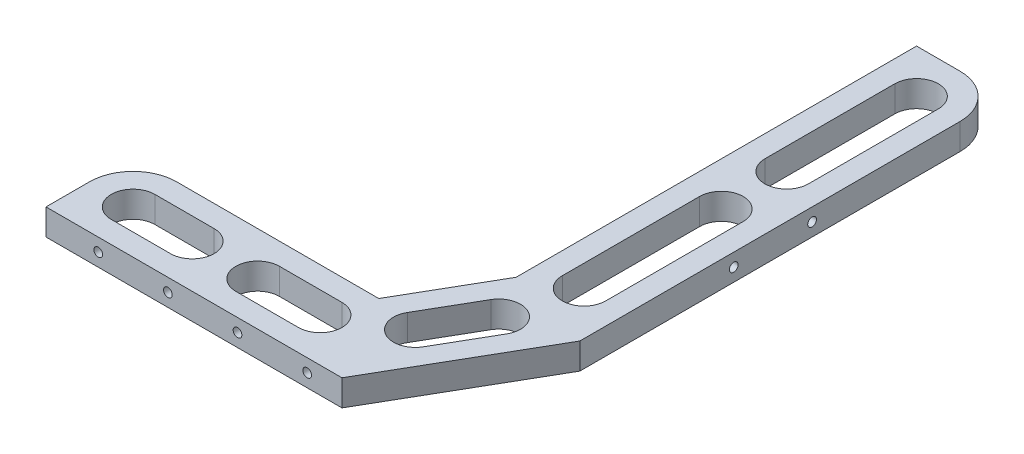
from build123d import *

# Parameters (mm, degrees)
BOSS_EXTRUDE1_DEPTH             = 15
CUT_EXTRUDE1_DEPTH              = 403.523291252
FILLET1_R                       = 25
TAP_DRILL_FOR_M6X1_0_TAP1_D     = 5
TAP_DRILL_FOR_M6X1_0_TAP1_DEPTH = 9
TAP_DRILL_FOR_M6X1_0_TAP1_TIP   = 1.502151548
TAP_DRILL_FOR_M6X1_0_TAP2_D     = 5
TAP_DRILL_FOR_M6X1_0_TAP2_DEPTH = 9
TAP_DRILL_FOR_M6X1_0_TAP2_TIP   = 1.502151548


# Read off the part's stored shape, not the designer's step: Tap Drill for M6x1.0 Tap3
with BuildPart() as part:
    # Sketch1 → Boss-Extrude1 (new body)
    with BuildSketch(Plane(origin=(0, 0, 0), x_dir=(1, 0, 0), z_dir=(0, 1, 0))):
        Polygon((-230, 50), (-88.867513459, 50), (-60, 100), (-60, 330), (-10, 330), (-10, 86.602540378), (-60, 0), (-230, 0), align=None)
    extrude(amount=BOSS_EXTRUDE1_DEPTH)

    # Sketch2 → Cut-Extrude1 (cut, through all)
    with BuildSketch(Plane(origin=(0, 15, 0), x_dir=(1, 0, 0), z_dir=(0, 1, 0))):
        with BuildLine():
            Line((-133.466878365, 37.5), (-97.527767497, 37.5))
            ThreePointArc((-97.527767497, 37.5), (-85.027767497, 25), (-97.527767497, 12.5))
            Line((-97.527767497, 12.5), (-133.466878365, 12.5))
            ThreePointArc((-133.466878365, 12.5), (-145.966878365, 25), (-133.466878365, 37.5))
        make_face()
        with BuildLine():
            Line((-73.712068893, 51.25), (-56.178079351, 81.619760746))
            ThreePointArc((-56.178079351, 81.619760746), (-39.102761804, 86.195078293), (-34.527444257, 69.119760746))
            Line((-34.527444257, 69.119760746), (-52.061433799, 38.75))
            ThreePointArc((-52.061433799, 38.75), (-69.136751346, 34.174682453), (-73.712068893, 51.25))
        make_face()
        with BuildLine():
            Line((-22.5, 192.900635095), (-22.5, 114.006793797))
            ThreePointArc((-22.5, 114.006793797), (-35, 101.506793797), (-47.5, 114.006793797))
            Line((-47.5, 114.006793797), (-47.5, 192.900635095))
            ThreePointArc((-47.5, 192.900635095), (-35, 205.400635095), (-22.5, 192.900635095))
        make_face()
        with BuildLine():
            Line((-47.5, 230.400635095), (-47.5, 305))
            ThreePointArc((-47.5, 305), (-35, 317.5), (-22.5, 305))
            Line((-22.5, 305), (-22.5, 230.400635095))
            ThreePointArc((-22.5, 230.400635095), (-35, 217.900635095), (-47.5, 230.400635095))
        make_face()
        with BuildLine():
            Line((-205, 37.5), (-170.966878365, 37.5))
            ThreePointArc((-170.966878365, 37.5), (-158.466878365, 25), (-170.966878365, 12.5))
            Line((-170.966878365, 12.5), (-205, 12.5))
            ThreePointArc((-205, 12.5), (-217.5, 25), (-205, 37.5))
        make_face()
    extrude(amount=-CUT_EXTRUDE1_DEPTH, mode=Mode.SUBTRACT)

    # Fillet1
    fillet1_edges = [part.edges().sort_by_distance(p)[0] for p in [
        (-10, 7.5, -330),
        (-230, 7.5, -50),
    ]]
    fillet(fillet1_edges, radius=FILLET1_R)

    # Tap Drill for M6x1.0 Tap1
    with Locations(Plane.XY):
        with Locations((-80, 7.5), (-200, 7.5), (-160, 7.5), (-120, 7.5)):
            Hole(TAP_DRILL_FOR_M6X1_0_TAP1_D / 2, depth=TAP_DRILL_FOR_M6X1_0_TAP1_DEPTH)
            with Locations((0, 0, -(TAP_DRILL_FOR_M6X1_0_TAP1_DEPTH + TAP_DRILL_FOR_M6X1_0_TAP1_TIP / 2))):  # 118° drill point
                Cone(0, TAP_DRILL_FOR_M6X1_0_TAP1_D / 2, TAP_DRILL_FOR_M6X1_0_TAP1_TIP, mode=Mode.SUBTRACT)

    # Tap Drill for M6x1.0 Tap2
    with Locations(Plane.ZY.offset(60)):
        with Locations((-230, 7.5), (-320, 7.5), (-290, 7.5), (-260, 7.5)):
            Hole(TAP_DRILL_FOR_M6X1_0_TAP2_D / 2, depth=TAP_DRILL_FOR_M6X1_0_TAP2_DEPTH)
            with Locations((0, 0, -(TAP_DRILL_FOR_M6X1_0_TAP2_DEPTH + TAP_DRILL_FOR_M6X1_0_TAP2_TIP / 2))):  # 118° drill point
                Cone(0, TAP_DRILL_FOR_M6X1_0_TAP2_D / 2, TAP_DRILL_FOR_M6X1_0_TAP2_TIP, mode=Mode.SUBTRACT)

    # Tap Drill for M6x1.0 Tap3 outline → Tap Drill for M6x1.0 Tap3 (revolve, cut)
    with BuildSketch(Plane(origin=(0, 7.5, -175), x_dir=(0, 1, 0), z_dir=(0, 0, -1))):
        Polygon((0, -10), (0, -20.502151548), (2.5, -19), (2.5, -10), align=None)
    revolve(axis=Axis((0, 7.5, -175), (1, 0, 0)), mode=Mode.SUBTRACT)

    # Tap Drill for M6x1.0 Tap3 2 outline → Tap Drill for M6x1.0 Tap3 2 (revolve, cut)
    with BuildSketch(Plane(origin=(0, 7.5, -220), x_dir=(0, 1, 0), z_dir=(0, 0, -1))):
        Polygon((0, -10), (0, -20.502151548), (2.5, -19), (2.5, -10), align=None)
    revolve(axis=Axis((0, 7.5, -220), (1, 0, 0)), mode=Mode.SUBTRACT)


solid = part.part
